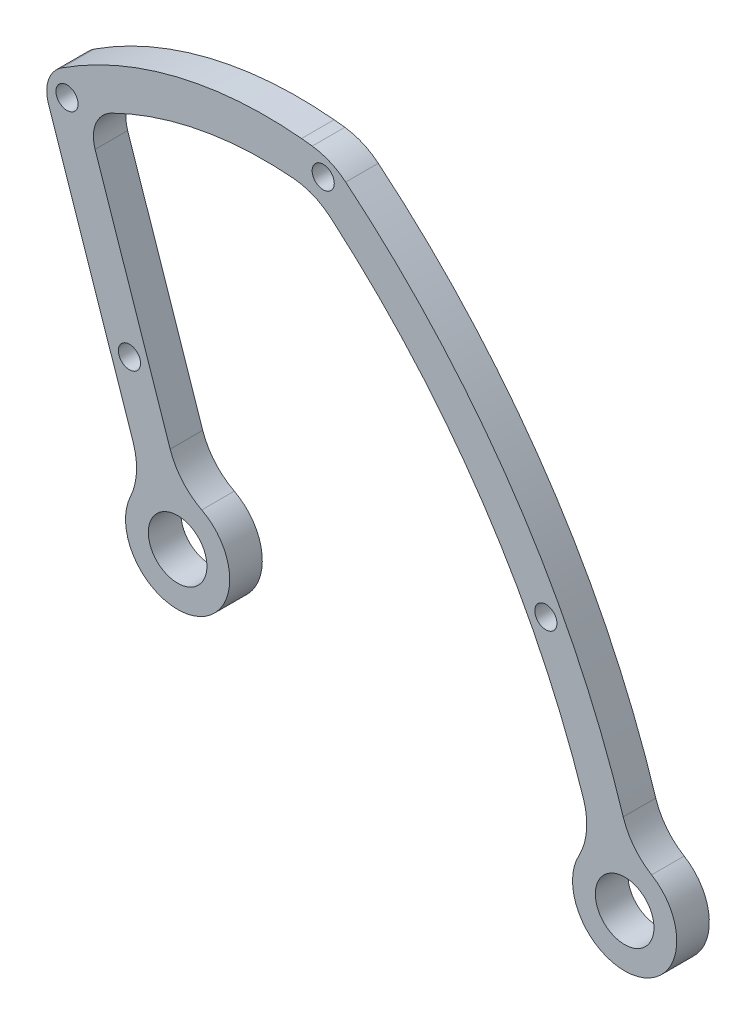
from build123d import *

# Parameters (mm, degrees)
SKETCH_2_R         = 1
SKETCH_2_R_2       = 4.5
EXTRUDE_1_DEPTH    = 5
HOLE_WIZARD_M3_1_D = 3.4


with BuildPart() as part:
    # ｽｹｯﾁ2 → ﾎﾞｽ - 押し出し1 (new body)
    with BuildSketch(Plane.XY):
        with BuildLine():
            Line((-103.472140065, 101.974881276), (-90.465628325, 63.493979587))
            ThreePointArc((-90.465628325, 63.493979587), (-89.954765024, 59.732746642), (-90.882432701, 56.052082673))
            ThreePointArc((-90.882432701, 56.052082673), (-81.075459946, 45.081398796), (-79.93528971, 59.752207608))
            ThreePointArc((-79.93528971, 59.752207608), (-82.905745012, 62.115309356), (-84.781534849, 65.415198302))
            Line((-84.781534849, 65.415198302), (-96.306113117, 99.511670303))
            ThreePointArc((-96.306113117, 99.511670303), (-96.187159058, 103.029978486), (-93.779139917, 105.597873802))
            ThreePointArc((-93.779139917, 105.597873802), (-80.151317429, 110.147426191), (-65.802869152, 110.880914253))
            ThreePointArc((-65.802869152, 110.880914253), (-62.79775687, 110.146159795), (-60.161017961, 108.5280832))
            ThreePointArc((-60.161017961, 108.5280832), (-36.743622956, 82.25702049), (-21.311725155, 50.627925419))
            ThreePointArc((-21.311725155, 50.627925419), (-20.854856748, 46.607677814), (-22.028392426, 42.735477722))
            ThreePointArc((-22.028392426, 42.735477722), (-12.907537143, 31.192758259), (-10.862618787, 45.76130941))
            ThreePointArc((-10.862618787, 45.76130941), (-13.545428623, 48.130915345), (-15.221875918, 51.293513228))
            ThreePointArc((-15.221875918, 51.293513228), (-31.975045674, 85.917727287), (-57.825293588, 114.400521722))
            ThreePointArc((-57.825293588, 114.400521722), (-60.237672636, 115.875551964), (-62.966502644, 116.616344559))
            ThreePointArc((-62.966502644, 116.616344559), (-63.790868964, 116.712759865), (-64.616469842, 116.797959229))
            ThreePointArc((-64.616469842, 116.797959229), (-83.805953809, 115.410758875), (-101.461958417, 107.767060748))
            ThreePointArc((-101.461958417, 107.767060748), (-103.459014386, 105.215233503), (-103.472140065, 101.974881276))
        make_face()
        with Locations((-91.031859186, 74.538276088)):
            Circle(SKETCH_2_R, mode=Mode.SUBTRACT)
        with Locations((-100.624843057, 104.231631526)):
            Circle(SKETCH_2_R, mode=Mode.SUBTRACT)
        with Locations((-61.284609553, 113.347883242)):
            Circle(SKETCH_2_R, mode=Mode.SUBTRACT)
        with Locations((-27.094783201, 71.932184414)):
            Circle(SKETCH_2_R, mode=Mode.SUBTRACT)
        with Locations((-83.637084901, 52.660190097)):
            Circle(SKETCH_2_R_2, mode=Mode.SUBTRACT)
        with Locations((-15, 38.914260651)):
            Circle(SKETCH_2_R_2, mode=Mode.SUBTRACT)
    extrude(amount=EXTRUDE_1_DEPTH)

    # M3 すきま穴1 (through all)
    with Locations(Plane.XY.offset(5)):
        with Locations((-91.031859186, 74.538276088), (-100.624843057, 104.231631526), (-61.284609553, 113.347883242), (-27.094783201, 71.932184414)):
            Hole(HOLE_WIZARD_M3_1_D / 2)


solid = part.part
